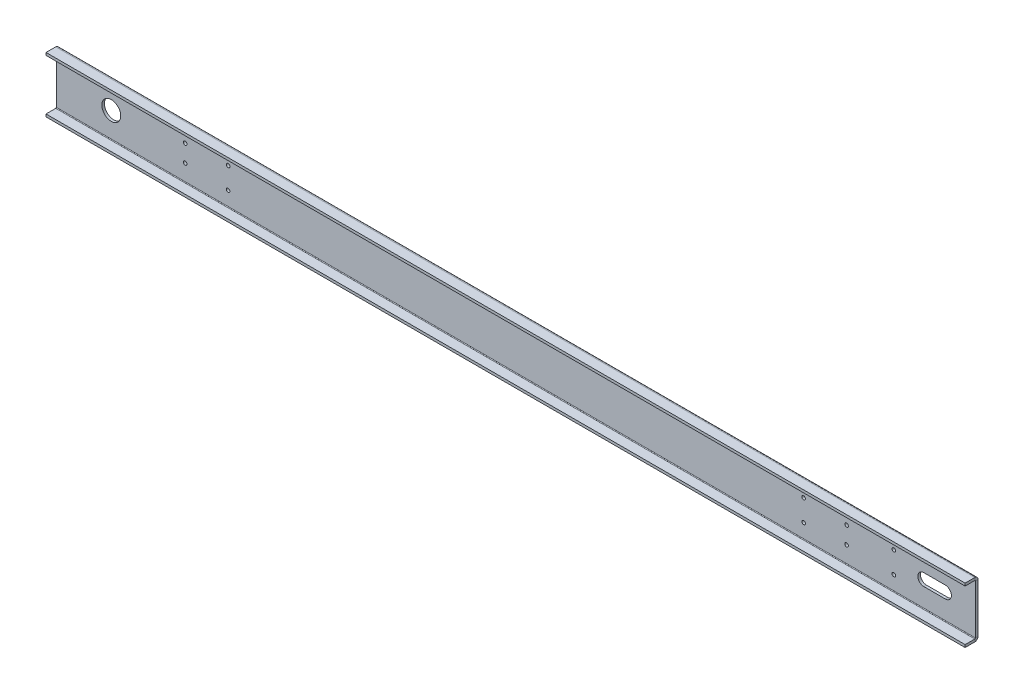
from build123d import *

# Parameters (mm, degrees)
TABAN_FLAN_1_DEPTH    = 535
KES_EKSTR_ZYON1_DEPTH = 10
M5_DI_LI_DELIK1_D     = 4.2
M5_DI_LI_DELIK2_D     = 4.2
M5_DI_LI_DELIK3_D     = 4.2
IZIM13_R              = 11
KES_EKSTR_ZYON2_DEPTH = 10


# Sheet-metal steps are written as plain solids
with BuildPart() as part:
    # Çizim1 → Taban-Flanş1 (new, symmetric)
    with BuildSketch(Plane(origin=(0, 0, 0), x_dir=(0, 0, -1), z_dir=(1, 0, 0))):
        with BuildLine():
            Line((-15, -32.5), (-3.7366, -32.5))
            ThreePointArc((-3.7366, -32.5), (-1.094424801, -31.405575199), (0, -28.7634))
            Line((0, -28.7634), (0, 28.7634))
            ThreePointArc((0, 28.7634), (-1.094424801, 31.405575199), (-3.7366, 32.5))
            Line((-3.7366, 32.5), (-15, 32.5))
            Line((-15, 32.5), (-15, 29.5))
            Line((-15, 29.5), (-3.7366, 29.5))
            ThreePointArc((-3.7366, 29.5), (-3.215745145, 29.284254855), (-3, 28.7634))
            Line((-3, 28.7634), (-3, -28.7634))
            ThreePointArc((-3, -28.7634), (-3.215745145, -29.284254855), (-3.7366, -29.5))
            Line((-3.7366, -29.5), (-15, -29.5))
            Line((-15, -29.5), (-15, -32.5))
        make_face()
    extrude(amount=TABAN_FLAN_1_DEPTH, both=True)

    # Çizim6 → Kes-Ekstrüzyon1 (cut)
    with BuildSketch(Plane(origin=(0, 0, 0), x_dir=(-1, 0, 0), z_dir=(0, 0, -1))):
        with BuildLine():
            Line((-500, 7), (-475, 7))
            ThreePointArc((-475, 7), (-468, 0), (-475, -7))
            Line((-475, -7), (-500, -7))
            ThreePointArc((-500, -7), (-507, 0), (-500, 7))
        make_face()
    extrude(amount=-KES_EKSTR_ZYON1_DEPTH, mode=Mode.SUBTRACT)

    # M5 Dişli Delik1 (through all)
    with Locations(Plane(origin=(440, 12.5, 0), x_dir=(-1, 0, 0), z_dir=(0, 0, -1))):
        with Locations((0, 0), (0, -25)):
            Hole(M5_DI_LI_DELIK1_D / 2)

    # M5 Dişli Delik2 (through all)
    with Locations(Plane(origin=(385, 10, 0), x_dir=(-1, 0, 0), z_dir=(0, 0, -1))):
        with Locations((0, 0), (0, -20)):
            m5_di_li_delik2 = Hole(M5_DI_LI_DELIK2_D / 2)

    # M5 Dişli Delik3 (through all)
    with Locations(Plane(origin=(335, 12.5, 0), x_dir=(-1, 0, 0), z_dir=(0, 0, -1))):
        with Locations((0, 0), (0, -25)):
            m5_di_li_delik3 = Hole(M5_DI_LI_DELIK3_D / 2)

    # Aynalama1: M5 Dişli Delik2, M5 Dişli Delik3 across plane
    add(m5_di_li_delik2.mirror(Plane(origin=(0, 0, 0), x_dir=(0, 0, 1), z_dir=(1, 0, 0))), mode=Mode.SUBTRACT)
    add(m5_di_li_delik3.mirror(Plane(origin=(0, 0, 0), x_dir=(0, 0, 1), z_dir=(1, 0, 0))), mode=Mode.SUBTRACT)

    # Çizim13 → Kes-Ekstrüzyon2 (cut)
    with BuildSketch(Plane(origin=(0, 0, 0), x_dir=(-1, 0, 0), z_dir=(0, 0, -1))):
        with Locations((471, 0)):
            Circle(IZIM13_R)
    extrude(amount=-KES_EKSTR_ZYON2_DEPTH, mode=Mode.SUBTRACT)


solid = part.part
